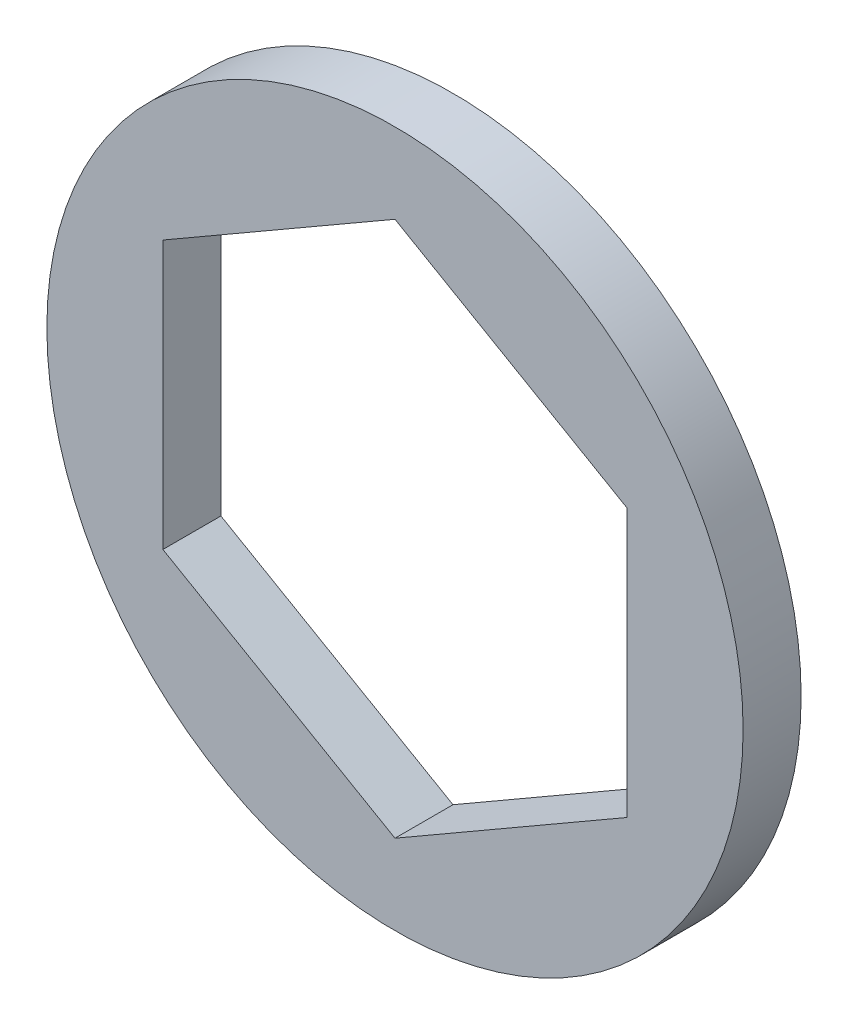
from build123d import *

# Parameters (mm, degrees)
SKETCH1_R           = 9.525
BOSS_EXTRUDE1_DEPTH = 1.5875


with BuildPart() as part:
    # Sketch1 → Boss-Extrude1 (new body)
    with BuildSketch(Plane.XY):
        Circle(SKETCH1_R)
        Polygon((0, 7.332348419), (-6.35, 3.666174209), (-6.35, -3.666174209), (0, -7.332348419), (6.35, -3.666174209), (6.35, 3.666174209), align=None, mode=Mode.SUBTRACT)
    extrude(amount=BOSS_EXTRUDE1_DEPTH)


solid = part.part
